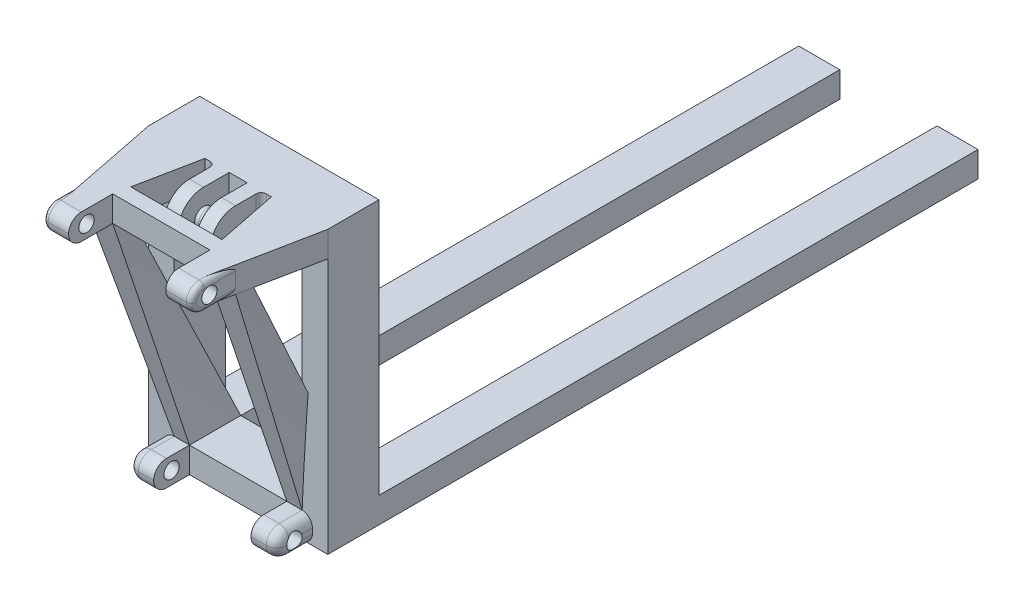
from build123d import *
from OCP.BRepFilletAPI import BRepFilletAPI_MakeChamfer

# Parameters (mm, degrees)
SKETCH1_W            = 35
SKETCH1_H            = 55
BOSS_EXTRUDE1_DEPTH  = 3
SKETCH2_W            = 5
SKETCH2_H            = 5
BOSS_EXTRUDE2_DEPTH  = 7
CUT_EXTRUDE1_REACH   = 45.362
FILLET1_R            = 2.5
SKETCH4_W            = 5
SKETCH4_H            = 5
BOSS_EXTRUDE3_DEPTH  = 16.61764706
CUT_EXTRUDE2_REACH   = 51.887
FILLET2_R            = 2.5
FILLET3_R            = 2
CHAMFER1_SIZE        = 3
CHAMFER1_SIZE_2      = 15
FILLET5_R            = 1
SKETCH6_W            = 2.75
SKETCH6_H            = 10
BOSS_EXTRUDE4_DEPTH  = 10
FILLET6_R            = 5
FILLET7_R            = 1
BOSS_EXTRUDE5_START  = -2.75
BOSS_EXTRUDE5_DEPTH  = 1.25
BOSS_EXTRUDE6_START  = -4
BOSS_EXTRUDE6_DEPTH  = 1.25
CHAMFER2_SIZE        = 3
CHAMFER2_SIZE2       = 15
BOSS_EXTRUDE7_REACH  = 48.364
SKETCH10_W           = 3
SKETCH10_H           = 5
SKETCH15_W           = 35
SKETCH15_H           = 55
BOSS_EXTRUDE8_DEPTH  = 7
CUT_EXTRUDE5_DEPTH   = 10
BOSS_EXTRUDE9_START  = -5
SKETCH19_W           = 5
SKETCH19_H           = 10
BOSS_EXTRUDE9_DEPTH  = 55
SKETCH21_W           = 8
SKETCH21_H           = 5
BOSS_EXTRUDE10_DEPTH = 117


with BuildPart() as part:
    # Sketch1 → Boss-Extrude1 (new body)
    with BuildSketch(Plane.XY):
        Rectangle(SKETCH1_W, SKETCH1_H)
    extrude(amount=BOSS_EXTRUDE1_DEPTH)

    # Sketch2 → Boss-Extrude2 (add)
    with BuildSketch(Plane.XY.offset(3)):
        with Locations((-12, 25)):
            Rectangle(SKETCH2_W, SKETCH2_H)
        with Locations((12, 25)):
            Rectangle(SKETCH2_W, SKETCH2_H)
        with Locations((-12, -25)):
            Rectangle(SKETCH2_W, SKETCH2_H)
        with Locations((12, -25)):
            Rectangle(SKETCH2_W, SKETCH2_H)
    extrude(amount=BOSS_EXTRUDE2_DEPTH)

    # Cut-Extrude1: up to this face of the body (flat: up to its plane)
    cut_extrude1_end = Plane(part.part.faces().sort_by_distance((14.5, 25, 6.5))[0])
    # Sketch3 → Cut-Extrude1 (cut, up to the picked face)
    with BuildSketch(Plane.ZY.offset(14.5), mode=Mode.PRIVATE) as cut_extrude1_sk1:
        with BuildLine():
            ThreePointArc((8, -25), (6.957766147, -23.571556737), (5.279399793, -24.128142709))
            Line((5.279399793, -24.128142709), (7.720600207, -25.871857291))
            ThreePointArc((7.720600207, -25.871857291), (7.928443263, -25.457766147), (8, -25))
        make_face()
    cut_extrude1_tool1 = split(extrude(cut_extrude1_sk1.sketch, amount=-CUT_EXTRUDE1_REACH, mode=Mode.PRIVATE), bisect_by=cut_extrude1_end, keep=Keep.BOTH, mode=Mode.PRIVATE)
    # Sketch3 → Cut-Extrude1 (cut, up to the picked face)
    with BuildSketch(Plane.ZY.offset(14.5), mode=Mode.PRIVATE) as cut_extrude1_sk2:
        with BuildLine():
            Line((7.720600207, -25.871857291), (5.279399793, -24.128142709))
            ThreePointArc((5.279399793, -24.128142709), (5.628142709, -26.220600207), (7.720600207, -25.871857291))
        make_face()
    cut_extrude1_tool2 = split(extrude(cut_extrude1_sk2.sketch, amount=-CUT_EXTRUDE1_REACH, mode=Mode.PRIVATE), bisect_by=cut_extrude1_end, keep=Keep.BOTH, mode=Mode.PRIVATE)
    # Sketch3 → Cut-Extrude1 (cut, up to the picked face)
    with BuildSketch(Plane.ZY.offset(14.5), mode=Mode.PRIVATE) as cut_extrude1_sk3:
        with BuildLine():
            ThreePointArc((8, -25), (6.957766147, -23.571556737), (5.279399793, -24.128142709))
            Line((5.279399793, -24.128142709), (7.720600207, -25.871857291))
            ThreePointArc((7.720600207, -25.871857291), (7.928443263, -25.457766147), (8, -25))
        make_face()
    cut_extrude1_tool3 = split(extrude(cut_extrude1_sk3.sketch, amount=-CUT_EXTRUDE1_REACH, mode=Mode.PRIVATE), bisect_by=cut_extrude1_end, keep=Keep.BOTH, mode=Mode.PRIVATE)
    # Sketch3 → Cut-Extrude1 (cut, up to the picked face)
    with BuildSketch(Plane.ZY.offset(14.5), mode=Mode.PRIVATE) as cut_extrude1_sk4:
        with BuildLine():
            Line((7.720600207, -25.871857291), (5.279399793, -24.128142709))
            ThreePointArc((5.279399793, -24.128142709), (5.628142709, -26.220600207), (7.720600207, -25.871857291))
        make_face()
    cut_extrude1_tool4 = split(extrude(cut_extrude1_sk4.sketch, amount=-CUT_EXTRUDE1_REACH, mode=Mode.PRIVATE), bisect_by=cut_extrude1_end, keep=Keep.BOTH, mode=Mode.PRIVATE)
    add(cut_extrude1_tool1.solids().sort_by(Axis((-14.5, -24.481961, 6.870028), (1, 0, 0)))[0], mode=Mode.SUBTRACT)
    add(cut_extrude1_tool2.solids().sort_by(Axis((-14.5, -25.518039, 6.129972), (1, 0, 0)))[0], mode=Mode.SUBTRACT)
    add(cut_extrude1_tool3.solids().sort_by(Axis((-14.5, -24.481961, 6.870028), (1, 0, 0)))[0], mode=Mode.SUBTRACT)
    add(cut_extrude1_tool4.solids().sort_by(Axis((-14.5, -25.518039, 6.129972), (1, 0, 0)))[0], mode=Mode.SUBTRACT)

    # Fillet1
    fillet1_edges = [part.edges().sort_by_distance(p)[0] for p in [
        (12, -27.5, 10),
        (12, -22.5, 10),
        (-12, -27.5, 10),
        (-12, -22.5, 10),
    ]]
    fillet(fillet1_edges, radius=FILLET1_R - 0.0001)  # a hair under: the kernel refuses the full size

    # Sketch4 → Boss-Extrude3 (add)
    with BuildSketch(Plane.XY.offset(10)):
        with Locations((-12, 25)):
            Rectangle(SKETCH4_W, SKETCH4_H)
        with Locations((12, 25)):
            Rectangle(SKETCH4_W, SKETCH4_H)
    extrude(amount=BOSS_EXTRUDE3_DEPTH)

    # Cut-Extrude2: up to this face of the body (flat: up to its plane)
    cut_extrude2_end = Plane(part.part.faces().sort_by_distance((14.5, 25, 14.80882353))[0])
    # Sketch5 → Cut-Extrude2 (cut, up to the picked face)
    with BuildSketch(Plane.ZY.offset(14.5), mode=Mode.PRIVATE) as cut_extrude2_sk1:
        with BuildLine():
            ThreePointArc((24.61764706, 25), (23.575413207, 26.428443263), (21.897046853, 25.871857291))
            Line((21.897046853, 25.871857291), (24.338247267, 24.128142709))
            ThreePointArc((24.338247267, 24.128142709), (24.546090323, 24.542233853), (24.61764706, 25))
        make_face()
    cut_extrude2_tool1 = split(extrude(cut_extrude2_sk1.sketch, amount=-CUT_EXTRUDE2_REACH, mode=Mode.PRIVATE), bisect_by=cut_extrude2_end, keep=Keep.BOTH, mode=Mode.PRIVATE)
    # Sketch5 → Cut-Extrude2 (cut, up to the picked face)
    with BuildSketch(Plane.ZY.offset(14.5), mode=Mode.PRIVATE) as cut_extrude2_sk2:
        with BuildLine():
            Line((24.338247267, 24.128142709), (21.897046853, 25.871857291))
            ThreePointArc((21.897046853, 25.871857291), (22.245789769, 23.779399793), (24.338247267, 24.128142709))
        make_face()
    cut_extrude2_tool2 = split(extrude(cut_extrude2_sk2.sketch, amount=-CUT_EXTRUDE2_REACH, mode=Mode.PRIVATE), bisect_by=cut_extrude2_end, keep=Keep.BOTH, mode=Mode.PRIVATE)
    # Sketch5 → Cut-Extrude2 (cut, up to the picked face)
    with BuildSketch(Plane.ZY.offset(14.5), mode=Mode.PRIVATE) as cut_extrude2_sk3:
        with BuildLine():
            ThreePointArc((24.61764706, 25), (23.575413207, 26.428443263), (21.897046853, 25.871857291))
            Line((21.897046853, 25.871857291), (24.338247267, 24.128142709))
            ThreePointArc((24.338247267, 24.128142709), (24.546090323, 24.542233853), (24.61764706, 25))
        make_face()
    cut_extrude2_tool3 = split(extrude(cut_extrude2_sk3.sketch, amount=-CUT_EXTRUDE2_REACH, mode=Mode.PRIVATE), bisect_by=cut_extrude2_end, keep=Keep.BOTH, mode=Mode.PRIVATE)
    # Sketch5 → Cut-Extrude2 (cut, up to the picked face)
    with BuildSketch(Plane.ZY.offset(14.5), mode=Mode.PRIVATE) as cut_extrude2_sk4:
        with BuildLine():
            Line((24.338247267, 24.128142709), (21.897046853, 25.871857291))
            ThreePointArc((21.897046853, 25.871857291), (22.245789769, 23.779399793), (24.338247267, 24.128142709))
        make_face()
    cut_extrude2_tool4 = split(extrude(cut_extrude2_sk4.sketch, amount=-CUT_EXTRUDE2_REACH, mode=Mode.PRIVATE), bisect_by=cut_extrude2_end, keep=Keep.BOTH, mode=Mode.PRIVATE)
    add(cut_extrude2_tool1.solids().sort_by(Axis((-14.5, 25.518039, 23.487675), (1, 0, 0)))[0], mode=Mode.SUBTRACT)
    add(cut_extrude2_tool2.solids().sort_by(Axis((-14.5, 24.481961, 22.747619), (1, 0, 0)))[0], mode=Mode.SUBTRACT)
    add(cut_extrude2_tool3.solids().sort_by(Axis((-14.5, 25.518039, 23.487675), (1, 0, 0)))[0], mode=Mode.SUBTRACT)
    add(cut_extrude2_tool4.solids().sort_by(Axis((-14.5, 24.481961, 22.747619), (1, 0, 0)))[0], mode=Mode.SUBTRACT)

    # Fillet2
    fillet2_edges = [part.edges().sort_by_distance(p)[0] for p in [
        (12, 22.5, 26.61764706),
        (12, 27.5, 26.61764706),
        (-12, 22.5, 26.61764706),
        (-12, 27.5, 26.61764706),
    ]]
    fillet(fillet2_edges, radius=FILLET2_R - 0.0001)  # a hair under: the kernel refuses the full size

    # Fillet3
    # the kernel refuses this fillet: 2 mm, written as the material it takes off along each edge
    with BuildSketch(Plane(origin=(14.5, -22.5, 3), x_dir=(0, -1, 0), z_dir=(0, 0, 1)), Plane(origin=(14.5, -27.5, 3), x_dir=(-1, 0, 0), z_dir=(0, 0, 1)), Plane(origin=(-14.5, -22.5, 3), x_dir=(1, 0, 0), z_dir=(0, 0, 1))) as fillet3_piece_1:
        with BuildLine():
            CenterArc((FILLET3_R, -FILLET3_R), FILLET3_R, 90, 90)
            Line((0, -FILLET3_R), (0, 0))
            Line((0, 0), (FILLET3_R, 0))
        make_face()
    extrude(amount=4.5001, mode=Mode.SUBTRACT)
    with BuildSketch(Plane(origin=(14.5, -24.9999, 7.5001), x_dir=(0, 0, 1), z_dir=(0, -1, 0))) as fillet3_piece_2:
        with BuildLine():
            CenterArc((2.4999 - FILLET3_R, FILLET3_R), FILLET3_R, 270, 90)
            Line((2.4999, FILLET3_R), (2.4999, 0))
            Line((2.4999, 0), (2.4999 - FILLET3_R, 0))
        make_face()
    revolve(axis=Axis((14.5, -24.9999, 7.5001), (-1, 0, 0)), revolution_arc=90, mode=Mode.SUBTRACT)
    with BuildSketch(Plane(origin=(14.5, -25.0001, 7.5001), x_dir=(0, -1, 0), z_dir=(0, 0, -1))) as fillet3_piece_3:
        with BuildLine():
            CenterArc((2.4999 - FILLET3_R, FILLET3_R), FILLET3_R, 270, 90)
            Line((2.4999, FILLET3_R), (2.4999, 0))
            Line((2.4999, 0), (2.4999 - FILLET3_R, 0))
        make_face()
    revolve(axis=Axis((14.5, -25.0001, 7.5001), (-1, 0, 0)), revolution_arc=90, mode=Mode.SUBTRACT)
    with BuildSketch(Plane(origin=(-14.5, -27.5, 3), x_dir=(1, 0, 0), z_dir=(0, 0, 1))) as fillet3_piece_4:
        with BuildLine():
            CenterArc((FILLET3_R, FILLET3_R), FILLET3_R, 180, 90)
            Line((0, FILLET3_R), (0, 0))
            Line((0, 0), (FILLET3_R, 0))
        make_face()
    extrude(amount=4.5001, mode=Mode.SUBTRACT)
    with BuildSketch(Plane(origin=(-14.5, -24.9999, 7.5001), x_dir=(0, 0, 1), z_dir=(0, -1, 0))) as fillet3_piece_5:
        with BuildLine():
            CenterArc((2.4999 - FILLET3_R, -FILLET3_R), FILLET3_R, 0, 90)
            Line((2.4999, -FILLET3_R), (2.4999, 0))
            Line((2.4999, 0), (2.4999 - FILLET3_R, 0))
        make_face()
    revolve(axis=Axis((-14.5, -24.9999, 7.5001), (-1, 0, 0)), revolution_arc=90, mode=Mode.SUBTRACT)
    with BuildSketch(Plane(origin=(-14.5, -25.0001, 7.5001), x_dir=(0, -1, 0), z_dir=(0, 0, -1))) as fillet3_piece_6:
        with BuildLine():
            CenterArc((2.4999 - FILLET3_R, -FILLET3_R), FILLET3_R, 0, 90)
            Line((2.4999, -FILLET3_R), (2.4999, 0))
            Line((2.4999, 0), (2.4999 - FILLET3_R, 0))
        make_face()
    revolve(axis=Axis((-14.5, -25.0001, 7.5001), (-1, 0, 0)), revolution_arc=90, mode=Mode.SUBTRACT)
    with BuildSketch(Plane(origin=(-14.5, -25.0001, 10), x_dir=(0, 0, -1), z_dir=(0, 1, 0))) as fillet3_piece_7:
        with BuildLine():
            CenterArc((FILLET3_R, -FILLET3_R), FILLET3_R, 90, 90)
            Line((0, -FILLET3_R), (0, 0))
            Line((0, 0), (FILLET3_R, 0))
        make_face()
    extrude(amount=0.0002, mode=Mode.SUBTRACT)
    with BuildSketch(Plane(origin=(14.5, -25.0001, 10), x_dir=(0, 0, -1), z_dir=(0, 1, 0))) as fillet3_piece_8:
        with BuildLine():
            CenterArc((FILLET3_R, FILLET3_R), FILLET3_R, 180, 90)
            Line((0, FILLET3_R), (0, 0))
            Line((0, 0), (FILLET3_R, 0))
        make_face()
    extrude(amount=0.0002, mode=Mode.SUBTRACT)

    # Chamfer1
    chamfer1_edges_1 = [part.edges().sort_by_distance(p)[0] for p in [
        (-14.5, 25, 3),
    ]]
    chamfer1_side_1 = [part.faces().sort_by_distance(p)[0] for p in [
        (-14.56, 25, 3),
    ]]
    chamfer1_edges_2 = [part.edges().sort_by_distance(p)[0] for p in [
        (14.5, 25, 3),
    ]]
    chamfer1_side_2 = [part.faces().sort_by_distance(p)[0] for p in [
        (14.5, 25, 3.06),
    ]]
    chamfer1 = BRepFilletAPI_MakeChamfer(part.part.solid().wrapped)
    for e in chamfer1_edges_1:
        chamfer1.Add(CHAMFER1_SIZE - 0.0001, CHAMFER1_SIZE_2 - 0.0001, e.wrapped, chamfer1_side_1[0].wrapped)
    for e in chamfer1_edges_2:
        chamfer1.Add(CHAMFER1_SIZE_2 - 0.0001, CHAMFER1_SIZE - 0.0001, e.wrapped, chamfer1_side_2[0].wrapped)
    add(Compound.cast(chamfer1.Shape()), mode=Mode.REPLACE)  # a hair under: the kernel refuses the full size

    # Fillet5
    fillet5_edges = [part.edges().sort_by_distance(p)[0] for p in [
        (14.5, 27.5, 21.05882353),
        (14.5, 22.5, 21.05882353),
        (14.5, 26.767796242, 25.885443302),
        (14.5, 23.232203758, 25.885443302),
        (-14.5, 27.5, 21.05882353),
        (-14.5, 22.5, 21.05882353),
        (-14.5, 26.767796242, 25.885443302),
        (-14.5, 23.232203758, 25.885443302),
    ]]
    fillet(fillet5_edges, radius=FILLET5_R - 0.0001)  # a hair under: the kernel refuses the full size

    # Sketch6 → Boss-Extrude4 (add)
    with BuildSketch(Plane.XY.offset(3)):
        with Locations((-3.125, 22.5)):
            Rectangle(SKETCH6_W, SKETCH6_H)
        with Locations((3.125, 22.5)):
            Rectangle(SKETCH6_W, SKETCH6_H)
    extrude(amount=BOSS_EXTRUDE4_DEPTH)

    # Fillet6
    fillet6_edges = [part.edges().sort_by_distance(p)[0] for p in [
        (-3.125, 17.5, 13),
        (3.125, 17.5, 13),
        (3.125, 27.5, 13),
        (-3.125, 27.5, 13),
    ]]
    fillet(fillet6_edges, radius=FILLET6_R - 0.0001)  # a hair under: the kernel refuses the full size

    # Fillet7
    fillet7_edges = [part.edges().sort_by_distance(p)[0] for p in [
        (-4.5, 22.5, 3),
        (4.5, 22.5, 3),
    ]]
    fillet(fillet7_edges, radius=FILLET7_R)

    # Sketch7 → Boss-Extrude5 (add)
    with BuildSketch(Plane.ZY.offset(4.5).offset(BOSS_EXTRUDE5_START)):
        with BuildLine():
            ThreePointArc((9.75, 22.5), (8.669696007, 24.116789182), (6.762563133, 23.737436867))
            Line((6.762563133, 23.737436867), (9.237436867, 21.262563133))
            ThreePointArc((9.237436867, 21.262563133), (9.616789182, 21.830303993), (9.75, 22.5))
        make_face()
        with BuildLine():
            Line((9.237436867, 21.262563133), (6.762563133, 23.737436867))
            ThreePointArc((6.762563133, 23.737436867), (6.762563133, 21.262563133), (9.237436867, 21.262563133))
        make_face()
    extrude(amount=-BOSS_EXTRUDE5_DEPTH)

    # Sketch9 → Boss-Extrude6 (add)
    with BuildSketch(Plane(origin=(4.5, 0, 0), x_dir=(0, 0, -1), z_dir=(1, 0, 0)).offset(BOSS_EXTRUDE6_START)):
        with BuildLine():
            ThreePointArc((-8, 24.25), (-9.75, 22.5), (-8, 20.75))
            Line((-8, 20.75), (-8, 24.25))
        make_face()
        with BuildLine():
            Line((-8, 24.25), (-8, 20.75))
            ThreePointArc((-8, 20.75), (-6.762563133, 21.262563133), (-6.25, 22.5))
            ThreePointArc((-6.25, 22.5), (-6.762563133, 23.737436867), (-8, 24.25))
        make_face()
    extrude(amount=BOSS_EXTRUDE6_DEPTH)

    # Chamfer2
    chamfer2_edges = [part.edges().sort_by_distance(p)[0] for p in [
        (-9.5, 25, 3),
        (9.5, 25, 3),
    ]]
    chamfer2_side = [part.faces().sort_by_distance(p)[0] for p in [
        (0, -1.464120363, 3),
    ]]
    chamfer(chamfer2_edges, length=CHAMFER2_SIZE, length2=CHAMFER2_SIZE2, reference=chamfer2_side[0])

    # Boss-Extrude7: up to this plane
    boss_extrude7_end = Plane(origin=(-9.5, 27.5, 18), z_dir=(0.9805806756909196, 0, 0.19611613513818726))
    # Sketch10 → Boss-Extrude7 (add, up to the surface)
    with BuildSketch(Plane(origin=(5.673076923, 0, -1.134615385), x_dir=(0.1961161351381873, 0, 0.9805806756909196), z_dir=(-0.9805806756909196, 0, 0.1961161351381873)), mode=Mode.PRIVATE) as boss_extrude7_sk1:
        with Locations((18.013555446, 25)):
            Rectangle(SKETCH10_W, SKETCH10_H)
    boss_extrude7_tool1 = split(extrude(boss_extrude7_sk1.sketch, amount=BOSS_EXTRUDE7_REACH, dir=(-1, 0, 0), mode=Mode.PRIVATE), bisect_by=boss_extrude7_end, keep=Keep.BOTH, mode=Mode.PRIVATE)
    add(boss_extrude7_tool1.solids().sort_by_distance((9.205826, 25, 16.529129))[0])

    # Fillet8: read off the stored shape, not the designer's step
    # Fillet8 outline → Fillet8 (revolve, cut)
    with BuildSketch(Plane(origin=(0, 22.5, 8), x_dir=(0, 1, 0), z_dir=(0, 0, -1))):
        with BuildLine():
            ThreePointArc((1.75, 1), (1.603553391, 0.646446609), (1.25, 0.5))
            Line((1.25, 0.5), (1.75, 0.5))
            Line((1.75, 0.5), (1.75, 1))
        make_face()
        with BuildLine():
            Line((1.75, -0.5), (1.25, -0.5))
            ThreePointArc((1.25, -0.5), (1.603553391, -0.646446609), (1.75, -1))
            Line((1.75, -1), (1.75, -0.5))
        make_face()
    revolve(axis=Axis((0, 22.5, 8), (1, 0, 0)), mode=Mode.SUBTRACT)

    # Sketch15 → Boss-Extrude8 (add)
    with BuildSketch(Plane(origin=(0, 0, 0), x_dir=(-1, 0, 0), z_dir=(0, 0, -1))):
        Rectangle(SKETCH15_W, SKETCH15_H)
    extrude(amount=BOSS_EXTRUDE8_DEPTH)

    # Sketch16 → Cut-Extrude5 (cut)
    with BuildSketch(Plane.XY.offset(3)):
        Polygon((-17.5, 22.5), (-17.5, 17.5), (-5.5, 17.5), align=None)
        Polygon((17.5, 22.5), (5.5, 17.5), (17.5, 17.5), align=None)
        Polygon((-17.5, 17.5), (-17.5, -22.5), (-12.5, -22.5), (-9.5, -22.5), (9.5, -22.5), (12.5, -22.5), (17.5, -22.5), (17.5, 17.5), (5.5, 17.5), (1.75, 17.5), (-1.75, 17.5), (-5.5, 17.5), align=None)
    extrude(amount=-CUT_EXTRUDE5_DEPTH, mode=Mode.SUBTRACT)


with BuildPart() as cut_extrude5_piece_1:
    # of the separate pieces the step leaves, piece 1, a body of its own (cut_extrude5_pieces)
    add(part.part.solids().sort_by_distance((6.5, 27.5, 3))[0])



with BuildPart() as cut_extrude5_piece_2:
    # of the separate pieces the step leaves, piece 2, a body of its own (cut_extrude5_pieces)
    add(part.part.solids().sort_by_distance((17.5, -27.5, 3))[0])


with BuildPart() as cut_extrude5_piece_1_1:
    add(cut_extrude5_piece_1.part)

    add(cut_extrude5_piece_2.part)  # Loft3 merges Cut-Extrude5 piece 2
    # Sketch13 → Loft3 section 0
    with BuildSketch(Plane.XZ.offset(-22.5)):
        with BuildLine():
            Line((9.5, 18), (8.911651595, 15.058257973))
            Line((8.911651595, 15.058257973), (15.088348405, 15.058257973))
            Line((15.088348405, 15.058257973), (14.5, 18))
            Line((14.5, 18), (9.5, 18))
        make_face()
    # Sketch17 → Loft3 section 1
    with BuildSketch(Plane(origin=(0, -22.5, 0), x_dir=(1, 0, 0), z_dir=(0, 1, 0))):
        with BuildLine():
            Line((12.5, -3), (9.5, -3))
            Line((9.5, -3), (9.5, 7))
            Line((9.5, 7), (12.5, 7))
            Line((12.5, 7), (12.5, -3))
        make_face()
    loft()

    # Sketch12 → Loft4 section 0
    with BuildSketch(Plane.XZ.offset(-22.5)):
        with BuildLine():
            Line((-9.5, 18), (-8.911651595, 15.058257973))
            Line((-8.911651595, 15.058257973), (-15.088348405, 15.058257973))
            Line((-15.088348405, 15.058257973), (-14.5, 18))
            Line((-14.5, 18), (-9.5, 18))
        make_face()
    # Sketch18 → Loft4 section 1
    with BuildSketch(Plane(origin=(0, -22.5, 0), x_dir=(1, 0, 0), z_dir=(0, 1, 0))):
        with BuildLine():
            Line((-12.5, -3), (-9.5, -3))
            Line((-9.5, -3), (-9.5, 7))
            Line((-9.5, 7), (-12.5, 7))
            Line((-12.5, 7), (-12.5, -3))
        make_face()
    loft()

    # Sketch19 → Boss-Extrude9 (add)
    with BuildSketch(Plane(origin=(0, -22.5, 0), x_dir=(1, 0, 0), z_dir=(0, 1, 0)).offset(BOSS_EXTRUDE9_START)):
        with Locations((15, 2)):
            Rectangle(SKETCH19_W, SKETCH19_H)
        with Locations((-15, 2)):
            Rectangle(SKETCH19_W, SKETCH19_H)
    extrude(amount=BOSS_EXTRUDE9_DEPTH)

    # Sketch21 → Boss-Extrude10 (add)
    with BuildSketch(Plane(origin=(0, 0, -7), x_dir=(-1, 0, 0), z_dir=(0, 0, -1))):
        with Locations((-13.5, -25)):
            Rectangle(SKETCH21_W, SKETCH21_H)
        with Locations((13.5, -25)):
            Rectangle(SKETCH21_W, SKETCH21_H)
    extrude(amount=BOSS_EXTRUDE10_DEPTH)


solid = cut_extrude5_piece_1_1.part
